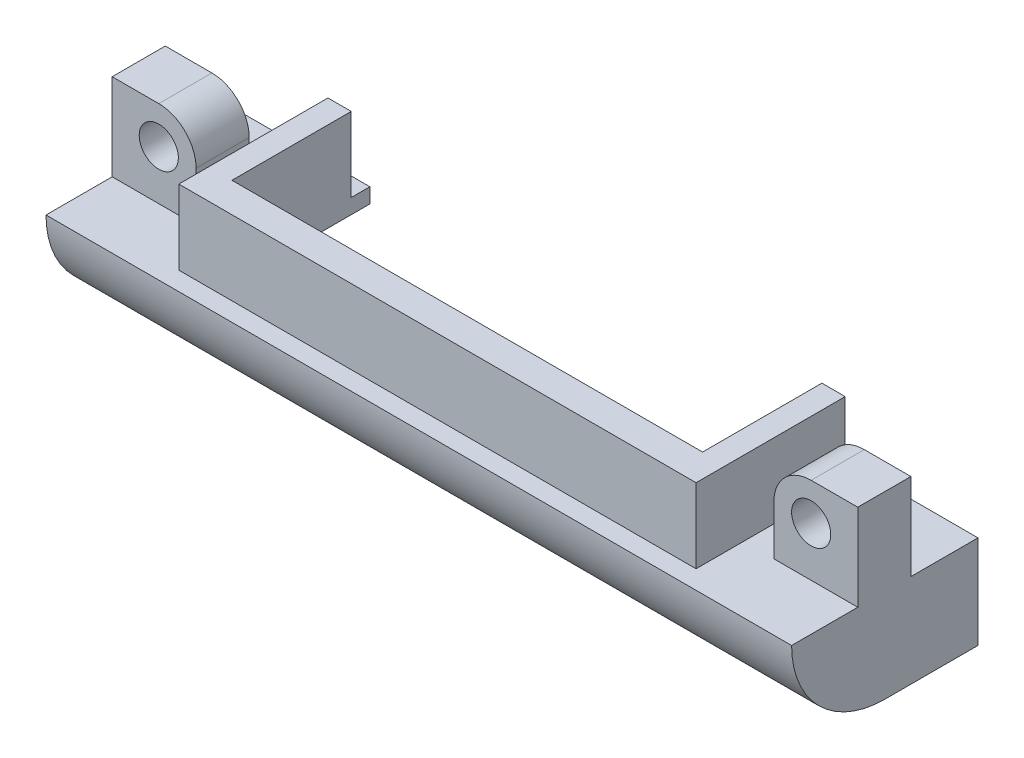
from build123d import *

# Parameters (mm, degrees)
BOSS_EXTRUDE1_DEPTH     = 20
SKETCH2_W               = 27.75
SKETCH2_H               = 8
BOSS_EXTRUDE2_DEPTH     = 4
CUT_EXTRUDE1_DEPTH      = 12.625
CUT_EXTRUDE1_DEPTH_BACK = 12.625
SKETCH6_W               = 4.5
SKETCH6_H               = 2.85
BOSS_EXTRUDE3_DEPTH     = 4.65
FILLET1_R               = 2
CUT_EXTRUDE2_REACH      = 23.586
SKETCH7_R               = 1.05
FILLET1_OF_MIRROR1_R    = 2
CUT_EXTRUDE3_START      = -16.5
CUT_EXTRUDE3_DEPTH      = 32
SHELL1_OUTLINE_W        = 2.3
SHELL1_OUTLINE_H        = 2.8
SHELL1_OUTLINE_W_2      = 1.3
SHELL1_DEPTH            = 5
SHELL1_START            = 4.7
SHELL1_2_DEPTH          = 0.65
SHELL1_START_2          = 16.6
SHELL1_3_DEPTH          = 2.3
SHELL1_START_3          = -18.9
SHELL1_4_DEPTH          = 1.3
SHELL1_START_4          = -17.6
SHELL1_5_DEPTH          = 34.2


with BuildPart() as part:
    # Sketch1 → Boss-Extrude1 (new, symmetric)
    with BuildSketch(Plane(origin=(0, 0, 0), x_dir=(0, 0, -1), z_dir=(1, 0, 0))):
        with BuildLine():
            Line((-10, 0), (0, 0))
            Line((0, 0), (0, -5))
            Line((0, -5), (-5, -5))
            ThreePointArc((-5, -5), (-8.535533906, -3.535533906), (-10, 0))
        make_face()
    extrude(amount=BOSS_EXTRUDE1_DEPTH, both=True)

    # Sketch2 → Boss-Extrude2 (add)
    with BuildSketch(Plane(origin=(0, 0, 0), x_dir=(1, 0, 0), z_dir=(0, 1, 0))):
        with Locations((0, -5)):
            Rectangle(SKETCH2_W, SKETCH2_H)
    extrude(amount=BOSS_EXTRUDE2_DEPTH)

    # Sketch4 → Cut-Extrude1 (cut, two sides: drawn at the far end of the back side and taken through both)
    with BuildSketch(Plane(origin=(0, 0, 0), x_dir=(0, 0, -1), z_dir=(1, 0, 0)).offset(-CUT_EXTRUDE1_DEPTH_BACK)):
        Polygon((-1, -0.8), (0, -0.8), (0, 4), (-7.4, 4), (-7.4, -0.8), align=None)
        with BuildLine():
            Line((-6.556434465, -3.161562797), (0, -4.2))
            Line((0, -4.2), (0, -0.8))
            Line((0, -0.8), (-1, -0.8))
            Line((-1, -0.8), (-7.4, -0.8))
            Line((-7.4, -0.8), (-7.4, -2.173874456))
            ThreePointArc((-7.4, -2.173874456), (-7.160405966, -2.823322504), (-6.556434465, -3.161562797))
        make_face()
    extrude(amount=CUT_EXTRUDE1_DEPTH + CUT_EXTRUDE1_DEPTH_BACK, mode=Mode.SUBTRACT)

    # Sketch6 → Boss-Extrude3 (add)
    with BuildSketch(Plane(origin=(0, 0, 0), x_dir=(1, 0, 0), z_dir=(0, 1, 0))):
        with Locations((-17.75, -5.025)):
            Rectangle(SKETCH6_W, SKETCH6_H)
    boss_extrude3 = extrude(amount=BOSS_EXTRUDE3_DEPTH)

    # Fillet1
    fillet1_edges = [part.edges().sort_by_distance(p)[0] for p in [
        (-15.5, 4.65, 5.025),
    ]]
    fillet(fillet1_edges, radius=FILLET1_R)

    # Sketch7 → Cut-Extrude2 (cut, up to next)
    with BuildSketch(Plane(origin=(0, 0, 3.6), x_dir=(-1, 0, 0), z_dir=(0, 0, -1)), mode=Mode.PRIVATE) as cut_extrude2_sk1:
        with Locations(Location((17.5, 2.65, 0), (0, 0, 90))):
            Circle(SKETCH7_R)
    cut_extrude2_tool1 = extrude(cut_extrude2_sk1.sketch, amount=-CUT_EXTRUDE2_REACH, mode=Mode.PRIVATE) & part.part
    cut_extrude2 = cut_extrude2_tool1.solids().sort_by_distance((-17.5, 2.65, 3.6))[0]
    add(cut_extrude2, mode=Mode.SUBTRACT)

    # Mirror1: Boss-Extrude3, Cut-Extrude2 across plane
    add(boss_extrude3.mirror(Plane(origin=(0, 0, 0), x_dir=(0, 0, 1), z_dir=(1, 0, 0))))
    add(cut_extrude2.mirror(Plane(origin=(0, 0, 0), x_dir=(0, 0, 1), z_dir=(1, 0, 0))), mode=Mode.SUBTRACT)

    # Fillet1 of Mirror1
    fillet1_of_mirror1_edges = [part.edges().sort_by_distance(p)[0] for p in [
        (15.5, 4.65, 5.025),
    ]]
    fillet(fillet1_of_mirror1_edges, radius=FILLET1_OF_MIRROR1_R)

    # Sketch4<3> → Cut-Extrude3 (cut)
    with BuildSketch(Plane(origin=(0, 0, 0), x_dir=(0, 0, -1), z_dir=(1, 0, 0)).offset(CUT_EXTRUDE3_START)):
        with BuildLine():
            Line((-6.556434465, -3.161562797), (0, -4.2))
            Line((0, -4.2), (0, -0.8))
            Line((0, -0.8), (-1, -0.8))
            Line((-1, -0.8), (-7.4, -0.8))
            Line((-7.4, -0.8), (-7.4, -2.173874456))
            ThreePointArc((-7.4, -2.173874456), (-7.160405966, -2.823322504), (-6.556434465, -3.161562797))
        make_face()
    extrude(amount=CUT_EXTRUDE3_DEPTH, mode=Mode.SUBTRACT)

    # Shell1: read off the stored shape, not the designer's step
    # Shell1 outline → Shell1 (cut)
    with BuildSketch(Plane.XY):
        with Locations((17.75, -2.5)):
            Rectangle(SHELL1_OUTLINE_W, SHELL1_OUTLINE_H)
        with Locations((-18.25, -2.5)):
            Rectangle(SHELL1_OUTLINE_W_2, SHELL1_OUTLINE_H)
    extrude(amount=SHELL1_DEPTH, mode=Mode.SUBTRACT)

    # Shell1 2 outline → Shell1 2 (cut)
    with BuildSketch(Plane.XY.offset(SHELL1_START)):
        with BuildLine():
            Line((16.6, 0.697437581), (16.6, -1.1))
            Line((16.6, -1.1), (18.9, -1.1))
            Line((18.9, -1.1), (18.9, 1.018283113))
            ThreePointArc((18.9, 1.018283113), (17.797044549, 0.520618743), (16.6, 0.697437581))
        make_face()
        with BuildLine():
            Line((-16.6, 0.3), (-16.6, 0.697437581))
            ThreePointArc((-16.6, 0.697437581), (-17.797044549, 0.520618743), (-18.9, 1.018283113))
            Line((-18.9, 1.018283113), (-18.9, -1.1))
            Line((-18.9, -1.1), (-17.6, -1.1))
            Line((-17.6, -1.1), (-17.6, 0.3))
            Line((-17.6, 0.3), (-16.6, 0.3))
        make_face()
    extrude(amount=SHELL1_2_DEPTH, mode=Mode.SUBTRACT)

    # Shell1 3 outline → Shell1 3 (cut)
    with BuildSketch(Plane.YZ.offset(SHELL1_START_2)):
        with BuildLine():
            Line((-3.9, 5), (-1.1, 5))
            Line((-1.1, 5), (-1.1, 8.741657387))
            ThreePointArc((-1.1, 8.741657387), (-3.122498999, 7.336664289), (-3.9, 5))
        make_face()
    extrude(amount=SHELL1_3_DEPTH, mode=Mode.SUBTRACT)

    # Shell1 4 outline → Shell1 4 (cut)
    with BuildSketch(Plane.YZ.offset(SHELL1_START_3)):
        with BuildLine():
            Line((-3.9, 5), (-1.1, 5))
            Line((-1.1, 5), (-1.1, 8.741657387))
            ThreePointArc((-1.1, 8.741657387), (-3.122498999, 7.336664289), (-3.9, 5))
        make_face()
    extrude(amount=SHELL1_4_DEPTH, mode=Mode.SUBTRACT)

    # Shell1 5 outline → Shell1 5 (cut)
    with BuildSketch(Plane.YZ.offset(SHELL1_START_4)):
        with BuildLine():
            ThreePointArc((-1.1, 8.741657387), (-1.415399361, 8.63409475), (-1.720465053, 8.5))
            Line((-1.720465053, 8.5), (-1.1, 8.5))
            Line((-1.1, 8.5), (-1.1, 8.741657387))
        make_face()
    extrude(amount=SHELL1_5_DEPTH, mode=Mode.SUBTRACT)


solid = part.part
